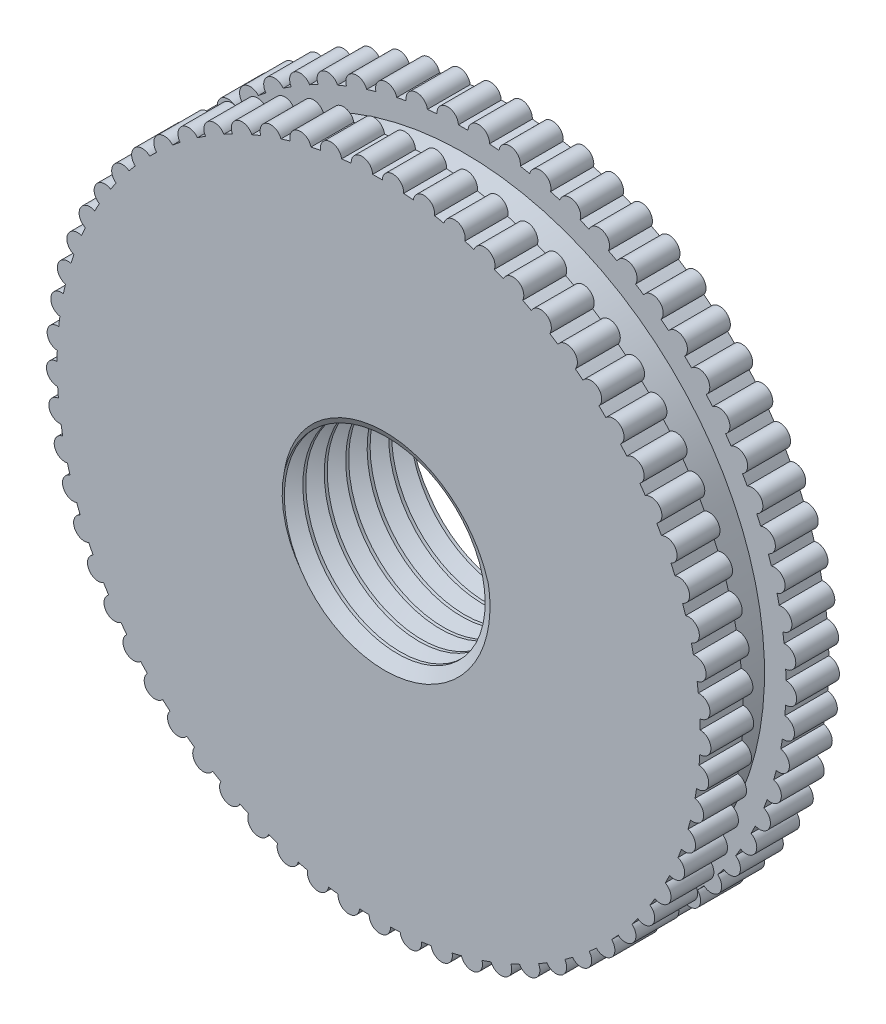
from build123d import *

# Parameters (mm, degrees)
SKETCH1_R               = 7.5
SKETCH1_R_2             = 2.25
BOSS_EXTRUDE1_DEPTH     = 3
CUT_SWEEP1_PITCH        = 0.5
CUT_EXTRUDE1_DEPTH      = 0.5
CUT_EXTRUDE1_DEPTH_BACK = 0.5
SKETCH5_R               = 7.5
SKETCH5_R_2             = 7
SKETCH6_R               = 0.25
BOSS_EXTRUDE3_DEPTH     = 1


with BuildPart() as part:
    # Sketch1 → Boss-Extrude1 (new body)
    with BuildSketch(Plane.XY):
        Circle(SKETCH1_R)
        Circle(SKETCH1_R_2, mode=Mode.SUBTRACT)
    extrude(amount=BOSS_EXTRUDE1_DEPTH)

    # Cut-Sweep1: arcs per turn and ends read off the stored shape
    # Cut-Sweep1: the profile of Sketch3 screwed along a right-hand helix through 9.5 turns, 6 arcs to a turn; built about Z, then put on its axis
    cut_sweep1_z = Axis((0, 0, 0), (0, 0, 1))
    cut_sweep1_corners = [(2.62315459, -0.000616553, -0.482567376), (2.207462396, 0.007866407, -0.722417411), (2.207462396, -0.009099513, -0.242717341)]
    with BuildLine(mode=Mode.PRIVATE) as cut_sweep1_profile:
        Line(cut_sweep1_corners[0], cut_sweep1_corners[1])
        Line(cut_sweep1_corners[1], cut_sweep1_corners[2])
        Line(cut_sweep1_corners[2], cut_sweep1_corners[0])
    cut_sweep1_cap = Face(cut_sweep1_profile.wire())
    cut_sweep1_turn_angles = [0, 30, 60, 90, 120, 150, 180, 210, 240, 270, 300, 330, 360]
    cut_sweep1_turn_weights = [1, 0.8660254037844387, 1, 0.8660254037844387, 1, 0.8660254037844387, 1, 0.8660254037844387, 1, 0.8660254037844387, 1, 0.8660254037844387, 1]
    cut_sweep1_turn_rails = [Edge.make_bspline([Vector(p[0], p[1], 0).rotate(cut_sweep1_z, cut_sweep1_turn_angles[k]) / cut_sweep1_turn_weights[k] + Vector(0, 0, p[2] + CUT_SWEEP1_PITCH * cut_sweep1_turn_angles[k] / 360) for k in range(13)], [0, 0, 0, 1, 1, 2, 2, 3, 3, 4, 4, 5, 5, 6, 6, 6], 2, cut_sweep1_turn_weights) for p in cut_sweep1_corners]
    cut_sweep1_turn_sides = [Face.make_surface_from_curves(cut_sweep1_turn_rails[p[0]], cut_sweep1_turn_rails[p[1]]) for p in [(0, 1), (1, 2), (2, 0)]]
    cut_sweep1_last_angles = [3240, 3270, 3300, 3330, 3360, 3390, 3420]
    cut_sweep1_last_weights = [1, 0.8660254037844387, 1, 0.8660254037844387, 1, 0.8660254037844387, 1]
    cut_sweep1_last_rails = [Edge.make_bspline([Vector(p[0], p[1], 0).rotate(cut_sweep1_z, cut_sweep1_last_angles[k]) / cut_sweep1_last_weights[k] + Vector(0, 0, p[2] + CUT_SWEEP1_PITCH * cut_sweep1_last_angles[k] / 360) for k in range(7)], [0, 0, 0, 1, 1, 2, 2, 3, 3, 3], 2, cut_sweep1_last_weights) for p in cut_sweep1_corners]
    cut_sweep1_last_sides = [Face.make_surface_from_curves(cut_sweep1_last_rails[p[0]], cut_sweep1_last_rails[p[1]]) for p in [(0, 1), (1, 2), (2, 0)]]
    cut_sweep1 = Plane(origin=(0, 0, 3), x_dir=(1, 0, 0), z_dir=(0, 0, -1)) * Solid(Shell([*[p.moved(Location((0, 0, CUT_SWEEP1_PITCH * i))) for i in range(9) for p in cut_sweep1_turn_sides], *cut_sweep1_last_sides, cut_sweep1_cap, cut_sweep1_cap.rotate(cut_sweep1_z, 3420).moved(Location((0, 0, CUT_SWEEP1_PITCH * 3420 / 360)))]))
    add(cut_sweep1, mode=Mode.SUBTRACT)

    # Sketch5 → Cut-Extrude1 (cut, two sides: drawn at the far end of the back side and taken through both)
    with BuildSketch(Plane(origin=(0, 0, 1.5), x_dir=(-1, 0, 0), z_dir=(0, 0, -1)).offset(-CUT_EXTRUDE1_DEPTH_BACK)):
        Circle(SKETCH5_R)
        Circle(SKETCH5_R_2, mode=Mode.SUBTRACT)
    extrude(amount=CUT_EXTRUDE1_DEPTH + CUT_EXTRUDE1_DEPTH_BACK, mode=Mode.SUBTRACT)

    # Sketch6 → Boss-Extrude3 (add)
    with BuildSketch(Plane(origin=(0, 0, 0), x_dir=(-1, 0, 0), z_dir=(0, 0, -1))):
        with Locations((7.397650533, 1.234814394)):
            Circle(SKETCH6_R)
        with Locations((7.482292377, 0.515073571)):
            Circle(SKETCH6_R)
        with Locations((7.497074073, -0.209476356)):
            Circle(SKETCH6_R)
        with Locations((7.441857608, -0.932070458)):
            Circle(SKETCH6_R)
        with Locations((7.317158524, -1.645962069)):
            Circle(SKETCH6_R)
        with Locations((7.124141102, -2.344485776)):
            Circle(SKETCH6_R)
        with Locations((6.864607495, -3.021119651)):
            Circle(SKETCH6_R)
        with Locations((6.540980896, -3.669546146)):
            Circle(SKETCH6_R)
        with Locations((6.156282922, -4.283711077)):
            Circle(SKETCH6_R)
        with Locations((5.714105392, -4.857880152)):
            Circle(SKETCH6_R)
        with Locations((5.2185768, -5.386692508)):
            Circle(SKETCH6_R)
        with Locations((4.674323763, -5.865210769)):
            Circle(SKETCH6_R)
        with Locations((4.086427824, -6.288967136)):
            Circle(SKETCH6_R)
        with Locations((3.460378009, -6.654005112)):
            Circle(SKETCH6_R)
        with Locations((2.802019577, -6.956916435)):
            Circle(SKETCH6_R)
        with Locations((2.117499444, -7.194872904)):
            Circle(SKETCH6_R)
        with Locations((1.413208788, -7.365652783)):
            Circle(SKETCH6_R)
        with Locations((0.695723383, -7.467661547)):
            Circle(SKETCH6_R)
        with Locations((-0.028257804, -7.499946766)):
            Circle(SKETCH6_R)
        with Locations((-0.751975155, -7.462207004)):
            Circle(SKETCH6_R)
        with Locations((-1.468671517, -7.354794625)):
            Circle(SKETCH6_R)
        with Locations((-2.171655288, -7.178712511)):
            Circle(SKETCH6_R)
        with Locations((-2.8543629, -6.935604691)):
            Circle(SKETCH6_R)
        with Locations((-3.510420094, -6.627741)):
            Circle(SKETCH6_R)
        with Locations((-4.133701441, -6.257995877)):
            Circle(SKETCH6_R)
        with Locations((-4.718387532, -5.829821532)):
            Circle(SKETCH6_R)
        with Locations((-5.25901931, -5.347215715)):
            Circle(SKETCH6_R)
        with Locations((-5.750549041, -4.814684385)):
            Circle(SKETCH6_R)
        with Locations((-6.188387446, -4.237199644)):
            Circle(SKETCH6_R)
        with Locations((-6.568446544, -3.620153312)):
            Circle(SKETCH6_R)
        with Locations((-6.887177827, -2.969306583)):
            Circle(SKETCH6_R)
        with Locations((-7.141605385, -2.29073624)):
            Circle(SKETCH6_R)
        with Locations((-7.329353699, -1.590777909)):
            Circle(SKETCH6_R)
        with Locations((-7.448669812, -0.875966913)):
            Circle(SKETCH6_R)
        with Locations((-7.498439702, -0.15297725)):
            Circle(SKETCH6_R)
        with Locations((-7.47819868, 0.57144072)):
            Circle(SKETCH6_R)
        with Locations((-7.388135733, 1.290523302)):
            Circle(SKETCH6_R)
        with Locations((-7.229091753, 1.997556615)):
            Circle(SKETCH6_R)
        with Locations((-7.00255169, 2.685939281)):
            Circle(SKETCH6_R)
        with Locations((-6.71063069, 3.349244056)):
            Circle(SKETCH6_R)
        with Locations((-6.356054339, 3.981277841)):
            Circle(SKETCH6_R)
        with Locations((-5.942133221, 4.576139507)):
            Circle(SKETCH6_R)
        with Locations((-5.472732006, 5.128274992)):
            Circle(SKETCH6_R)
        with Locations((-4.952233367, 5.632529155)):
            Circle(SKETCH6_R)
        with Locations((-4.385497059, 6.084193911)):
            Circle(SKETCH6_R)
        with Locations((-3.777814547, 6.479052188)):
            Circle(SKETCH6_R)
        with Locations((-3.134859598, 6.8134173)):
            Circle(SKETCH6_R)
        with Locations((-2.46263531, 7.08416737)):
            Circle(SKETCH6_R)
        with Locations((-1.767418059, 7.288774479)):
            Circle(SKETCH6_R)
        with Locations((-1.055698903, 7.425328264)):
            Circle(SKETCH6_R)
        with Locations((-0.33412297, 7.49255376)):
            Circle(SKETCH6_R)
        with Locations((0.390572579, 7.4898233)):
            Circle(SKETCH6_R)
        with Locations((1.111621457, 7.417162378)):
            Circle(SKETCH6_R)
        with Locations((1.822291426, 7.275249409)):
            Circle(SKETCH6_R)
        with Locations((2.51594715, 7.065409397)):
            Circle(SKETCH6_R)
        with Locations((3.186112153, 6.78960156)):
            Circle(SKETCH6_R)
        with Locations((3.826529286, 6.450401044)):
            Circle(SKETCH6_R)
        with Locations((4.431219145, 6.050974871)):
            Circle(SKETCH6_R)
        with Locations((4.994535906, 5.595052375)):
            Circle(SKETCH6_R)
        with Locations((5.51122003, 5.086890384)):
            Circle(SKETCH6_R)
        with Locations((5.976447378, 4.531233467)):
            Circle(SKETCH6_R)
        with Locations((6.385874247, 3.933269645)):
            Circle(SKETCH6_R)
        with Locations((6.735677929, 3.298581943)):
            Circle(SKETCH6_R)
        with Locations((7.022592401, 2.633096271)):
            Circle(SKETCH6_R)
        with Locations((7.24393882, 1.943026088)):
            Circle(SKETCH6_R)
    boss_extrude3 = extrude(amount=-BOSS_EXTRUDE3_DEPTH)

    # Mirror1: Boss-Extrude3 across plane
    add(boss_extrude3.mirror(Plane(origin=(0, 0, 1.5), x_dir=(1, 0, 0), z_dir=(0, 0, -1))))


solid = part.part
